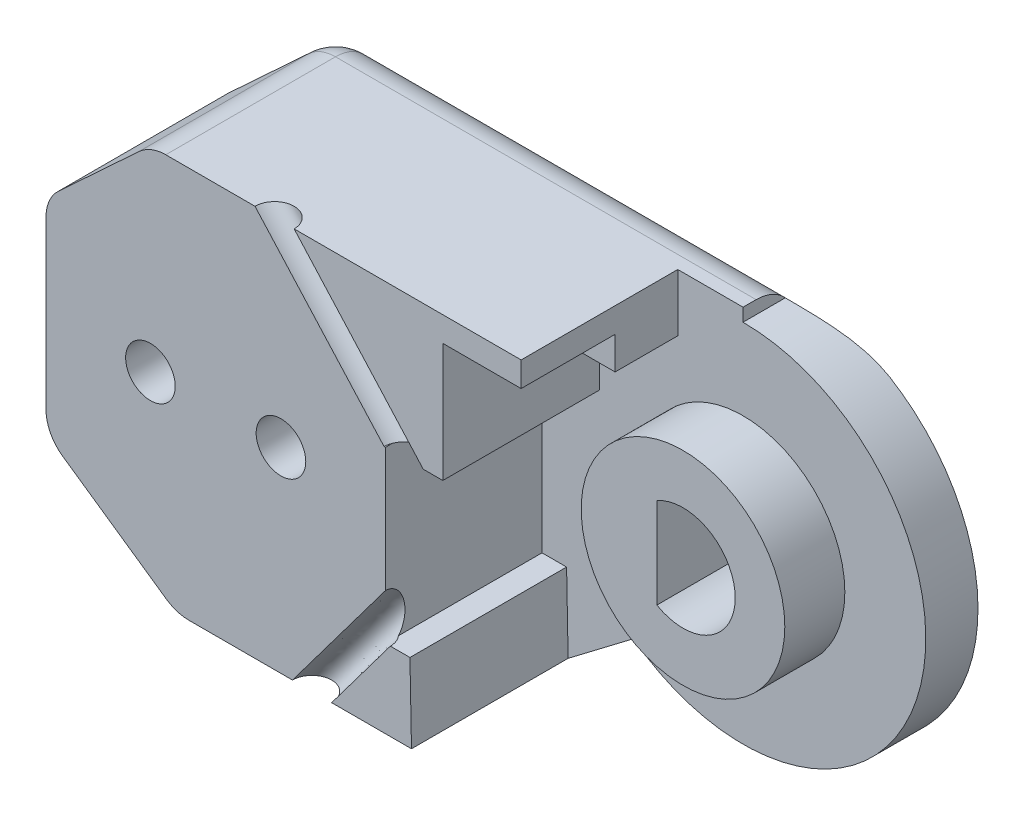
from build123d import *

# Parameters (mm, degrees)
BOSS_EXTRUDE1_DEPTH      = 2
BOSS_EXTRUDE2_DEPTH      = 6
SKETCH24_R               = 3.9
BOSS_EXTRUDE5_DEPTH      = 2.3
SKETCH30_W               = 2.408612022
SKETCH30_H               = 1.324178481
CUT_EXTRUDE12_DEPTH      = 8
CUT_EXTRUDE11_DEPTH      = 23.432788503
FILLET1_R                = 1.5
SKETCH34_R               = 0.75
CUT_EXTRUDE13_DEPTH      = 8
SKETCH35_R               = 0.75
CUT_EXTRUDE14_DEPTH      = 3
CUT_EXTRUDE14_DEPTH_BACK = 8
SKETCH36_R               = 0.95
CUT_EXTRUDE15_DEPTH      = 8
SKETCH37_R               = 2
CUT_EXTRUDE16_DEPTH      = 2.5
SKETCH38_W               = 3
SKETCH38_H               = 1.25
CUT_EXTRUDE17_DEPTH      = 3.6


with BuildPart() as part:
    # Sketch2 → Boss-Extrude1 (new body)
    with BuildSketch(Plane.XY):
        with BuildLine():
            Line((-2.5, 7.5), (-16.7, 7.5))
            Line((-16.7, 7.5), (-20.7, 3.793442666))
            Line((-20.7, 3.793442666), (-20.7, -4.031648778))
            Line((-20.7, -4.031648778), (-15.7, -7.5))
            Line((-15.7, -7.5), (-6.7, -7.5))
            Line((-6.7, -7.5), (-4.2, -5.6))
            ThreePointArc((-4.2, -5.6), (3.130495168, -6.260990337), (7, 0))
            ThreePointArc((7, 0), (4.949747468, 4.949747468), (0, 7))
            Line((0, 7), (0, 7.5))
            Line((0, 7.5), (-2.5, 7.5))
        make_face()
    extrude(amount=BOSS_EXTRUDE1_DEPTH)

    # Sketch4 → Boss-Extrude2 (add)
    with BuildSketch(Plane.XY.offset(2)):
        Polygon((-15.7, -7.5), (-6.7, -7.5), (-6.759079174, -4.5), (-7.7, -4.5), (-7.7, 2), (-5.5, 2), (-5.5, 5.3), (-2.5, 5.3), (-2.5, 7.5), (-16.7, 7.5), (-20.7, 3.793442666), (-20.7, -4.031648778), align=None)
    extrude(amount=BOSS_EXTRUDE2_DEPTH)

    # Sketch24 → Boss-Extrude5 (add)
    with BuildSketch(Plane.XY.offset(2)):
        Circle(SKETCH24_R)
    extrude(amount=BOSS_EXTRUDE5_DEPTH)

    # Sketch30 → Cut-Extrude12 (cut)
    with BuildSketch(Plane(origin=(-5.5, 0, 0), x_dir=(0, 0, -1), z_dir=(1, 0, 0))):
        with Locations((-3.261593395, 4.63791076)):
            Rectangle(SKETCH30_W, SKETCH30_H)
    extrude(amount=-CUT_EXTRUDE12_DEPTH, mode=Mode.SUBTRACT)

    # Sketch28 → Cut-Extrude11 (cut, through all)
    with BuildSketch(Plane.XY.offset(4.3)):
        with BuildLine():
            Line((-1, 1.732050808), (-1, -1.732050808))
            ThreePointArc((-1, -1.732050808), (2, 0), (-1, 1.732050808))
        make_face()
    extrude(amount=-CUT_EXTRUDE11_DEPTH, mode=Mode.SUBTRACT)

    # Fillet1
    fillet1_edges = [part.edges().sort_by_distance(p)[0] for p in [
        (-11.2, -7.5, 0),
        (-8.35, 7.5, 0),
        (-18.7, 5.646721333, 0),
        (-18.2, -5.765824389, 0),
        (-20.7, -0.119103056, 0),
        (-15.7, -7.5, 4),
        (-20.7, -4.031648778, 4),
        (-20.7, 3.793442666, 4),
        (-16.7, 7.5, 4),
    ]]
    fillet(fillet1_edges, radius=FILLET1_R)

    # Sketch34 → Cut-Extrude13 (cut, along a direction that is not the sketch's normal)
    with BuildSketch(Plane.XZ.offset(-2)):
        with Locations((-7, 8)):
            Circle(SKETCH34_R)
    extrude(amount=-CUT_EXTRUDE13_DEPTH, dir=(0.6685833876565112, -0.7436371788377336, 0), mode=Mode.SUBTRACT)

    # Sketch35 → Cut-Extrude14 (cut, two sides, along a direction that is not the sketch's normal)
    with BuildSketch(Plane(origin=(0, -4.5, 0), x_dir=(1, 0, 0), z_dir=(0, 1, 0))) as cut_extrude14_sk:
        with Locations((-8.259079174, -8)):
            Circle(SKETCH35_R)
    extrude(amount=CUT_EXTRUDE14_DEPTH, dir=(0.5999194182208608, 0.8000604299935998, 0), mode=Mode.SUBTRACT)
    extrude(cut_extrude14_sk.sketch, amount=-CUT_EXTRUDE14_DEPTH_BACK, dir=(0.5999194182208608, 0.8000604299935998, 0), mode=Mode.SUBTRACT)

    # Sketch36 → Cut-Extrude15 (cut)
    with BuildSketch(Plane.XY.offset(8)):
        with Locations((-11.7, 0)):
            Circle(SKETCH36_R)
        with Locations((-16.7, 0)):
            Circle(SKETCH36_R)
    extrude(amount=-CUT_EXTRUDE15_DEPTH, mode=Mode.SUBTRACT)

    # Sketch37 → Cut-Extrude16 (cut)
    with BuildSketch(Plane(origin=(0, 0, 0), x_dir=(-1, 0, 0), z_dir=(0, 0, -1))):
        with Locations((11.7, 0)):
            Circle(SKETCH37_R)
        with Locations((16.7, 0)):
            Circle(SKETCH37_R)
    extrude(amount=-CUT_EXTRUDE16_DEPTH, mode=Mode.SUBTRACT)

    # Sketch38 → Cut-Extrude17 (cut)
    with BuildSketch(Plane.XY.offset(8)):
        with Locations((-4, 5.925)):
            Rectangle(SKETCH38_W, SKETCH38_H)
    extrude(amount=-CUT_EXTRUDE17_DEPTH, mode=Mode.SUBTRACT)


solid = part.part
